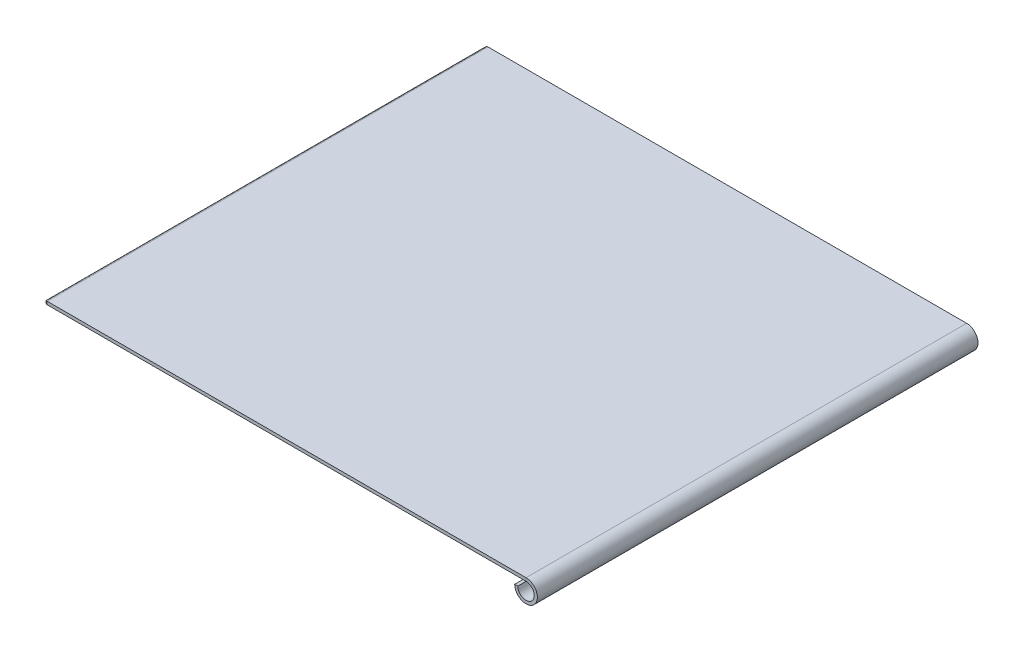
from build123d import *

# Parameters (mm, degrees)
SKETCH_1_W             = 234
SKETCH_1_H             = 214
SM_BASE_FLANGE_1_DEPTH = 1.5
OTHER_START            = -107
OTHER_1_DEPTH          = 214
FILLET_3_R             = 1.5


# Read off the part's stored shape, not the designer's step: Каемка1
# Sheet-metal steps are written as plain solids
with BuildPart() as part:
    # Sketch 1 → Базовая кромка1 (new body)
    with BuildSketch(Plane.XZ.offset(1.5)):
        Rectangle(SKETCH_1_W, SKETCH_1_H)
    extrude(amount=-SM_BASE_FLANGE_1_DEPTH)

    # Other 1 outline → Other 1 (add)
    with BuildSketch(Plane.XY.offset(OTHER_START)):
        with BuildLine():
            Line((113, -5.5), (111.5, -5.5))
            ThreePointArc((111.5, -5.5), (120.889087297, -9.389087297), (117, 0))
            Line((117, 0), (117, -1.5))
            ThreePointArc((117, -1.5), (119.828427125, -8.328427125), (113, -5.5))
        make_face()
    extrude(amount=OTHER_1_DEPTH)

    # Скругление3
    # the kernel refuses this fillet: 1.5 mm, written as the material it takes off along each edge
    with BuildSketch(Plane(origin=(-117, 0, -110.75), x_dir=(0, -1, 0), z_dir=(0, 0, 1))) as fillet_3_piece_1:
        with BuildLine():
            CenterArc((FILLET_3_R, FILLET_3_R), FILLET_3_R, 180, 90)
            Line((0, FILLET_3_R), (0, 0))
            Line((0, 0), (FILLET_3_R, 0))
        make_face()
    extrude(amount=221.5, mode=Mode.SUBTRACT)
    with BuildSketch(Plane(origin=(-117, -1.5, -110.75), x_dir=(0, 1, 0), z_dir=(0, 0, 1))) as fillet_3_piece_2:
        with BuildLine():
            CenterArc((FILLET_3_R, -FILLET_3_R), FILLET_3_R, 90, 90)
            Line((0, -FILLET_3_R), (0, 0))
            Line((0, 0), (FILLET_3_R, 0))
        make_face()
    extrude(amount=221.5, mode=Mode.SUBTRACT)
    with BuildSketch(Plane(origin=(-117, -5.25, -107), x_dir=(0, 0, 1), z_dir=(0, 1, 0)), Plane(origin=(-117, -5.25, 107), x_dir=(1, 0, 0), z_dir=(0, 1, 0))) as fillet_3_piece_3:
        with BuildLine():
            CenterArc((FILLET_3_R, FILLET_3_R), FILLET_3_R, 180, 90)
            Line((0, FILLET_3_R), (0, 0))
            Line((0, 0), (FILLET_3_R, 0))
        make_face()
    extrude(amount=9, mode=Mode.SUBTRACT)


solid = part.part
